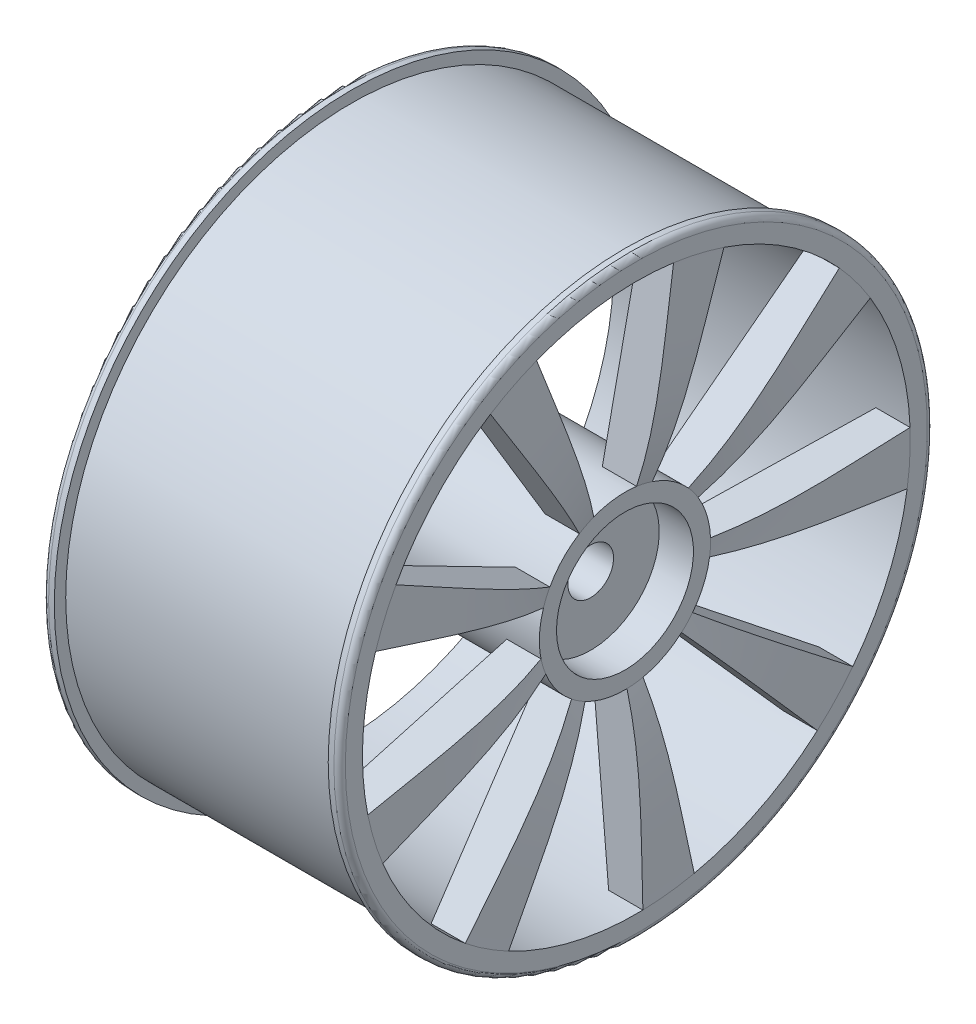
from build123d import *
from build123d.topology import SkipClean

# Parameters (mm, degrees)
CUT_EXTRUDE2_DEPTH  = 10
CIRPATTERN1_COUNT   = 9
CUT_EXTRUDE9_DEPTH  = 5
BOSS_EXTRUDE2_START = -5
SKETCH7_R           = 6
BOSS_EXTRUDE2_DEPTH = 5
SKETCH8_R           = 2
CUT_EXTRUDE10_DEPTH = 6


with BuildPart() as part:
    # Sketch1 → Revolve1 (revolve)
    with BuildSketch(Plane(origin=(0, 0, 0), x_dir=(1, 0, 0), z_dir=(0, 1, 0))):
        with BuildLine():
            Line((-13, 24), (10, 24))
            Line((10, 24), (9, 7.5))
            Line((9, 7.5), (-1, 7.5))
            Line((-1, 7.5), (-1, 6))
            Line((-1, 6), (12, 6))
            Line((12, 6), (12, 7.5))
            add(Edge.make_bspline(
                [(13, 24), (12.945427236, 18.482405329), (13.269747448, 12.974355238), (12, 7.5)],
                knots=[0, 0, 0, 0, 1, 1, 1, 1], degree=3))
            Line((13, 24), (13, 25.5))
            ThreePointArc((13, 25.5), (12.853553391, 25.853553391), (12.5, 26))
            Line((12.5, 26), (12, 26))
            Line((12, 26), (12, 25))
            Line((12, 25), (-12, 25))
            Line((-12, 25), (-12, 26))
            Line((-12, 26), (-12.5, 26))
            ThreePointArc((-12.5, 26), (-12.853553391, 25.853553391), (-13, 25.5))
            Line((-13, 25.5), (-13, 24))
        make_face()
    revolve(axis=Axis((-89.555555556, 0, 0), (1, 0, 0)))

    # Sketch2 → Cut-Extrude2 (cut)
    with SkipClean():  # the faces are left unmerged after this step: merging them gives an invalid solid
        with BuildSketch(Plane(origin=(13, 0, 0), x_dir=(0, 0, -1), z_dir=(1, 0, 0))):
            with BuildLine():
                Line((-2.731619252, 6.984859072), (-8.741181606, 22.351549032))
                ThreePointArc((-8.741181606, 22.351549032), (-2.83241408, 23.832277073), (3.258818394, 23.777722824))
                Line((3.258818394, 23.777722824), (1.018380748, 7.430538382))
                ThreePointArc((1.018380748, 7.430538382), (-0.8851294, 7.447586585), (-2.731619252, 6.984859072))
            make_face()
        cut_extrude2 = extrude(amount=-CUT_EXTRUDE2_DEPTH, mode=Mode.SUBTRACT)
    add(part.part.scale(1), mode=Mode.REPLACE)  # the faces are merged on a copy

    # CirPattern1: Cut-Extrude2 ×9 about axis
    cirpattern1_axis = Axis((12, 0, 0), (-1, 0, 0))
    for i in range(1, CIRPATTERN1_COUNT):
        add(cut_extrude2.rotate(cirpattern1_axis, i * 360 / CIRPATTERN1_COUNT), mode=Mode.SUBTRACT)

    # Sketch6 → Cut-Extrude9 (cut)
    with BuildSketch(Plane.ZY.offset(1)):
        Polygon((-5.409909398, -4.629762059), (1.304536857, -7), (6.714446255, -2.370237941), (5.409909398, 4.629762059), (-1.304536857, 7), (-6.714446255, 2.370237941), align=None)
    extrude(amount=-CUT_EXTRUDE9_DEPTH, mode=Mode.SUBTRACT)

    # Sketch7 → Boss-Extrude2 (add)
    with BuildSketch(Plane.ZY.offset(-4).offset(BOSS_EXTRUDE2_START)):
        Circle(SKETCH7_R)
    extrude(amount=BOSS_EXTRUDE2_DEPTH)

    # Sketch8 → Cut-Extrude10 (cut)
    with SkipClean():  # the faces are left unmerged after this step: merging them gives an invalid solid
        with BuildSketch(Plane(origin=(9, 0, 0), x_dir=(0, 0, -1), z_dir=(1, 0, 0))):
            Circle(SKETCH8_R)
        extrude(amount=-CUT_EXTRUDE10_DEPTH, mode=Mode.SUBTRACT)


solid = part.part
